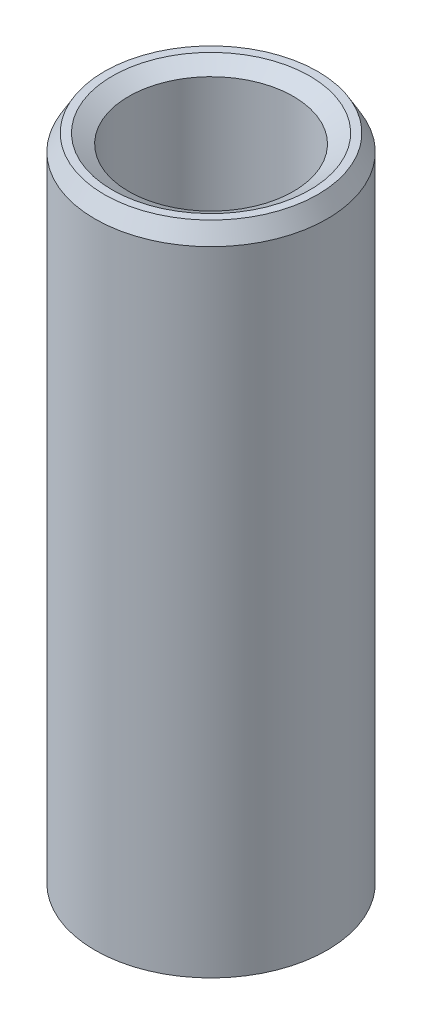
from build123d import *
from OCP.BRepFilletAPI import BRepFilletAPI_MakeChamfer

# Parameters (mm, degrees)
SKETCH1_R           = 15
BOSS_EXTRUDE1_DEPTH = 85.132446652
SKETCH2_R           = 10.638001271
CUT_EXTRUDE1_DEPTH  = 88.735588406
CHAMFER1_SIZE       = 2.114480144
CHAMFER1_SIZE2      = 1.22079568


with BuildPart() as part:
    # Sketch1 → Boss-Extrude1 (new body)
    with BuildSketch(Plane(origin=(0, 0, 0), x_dir=(1, 0, 0), z_dir=(0, 1, 0))):
        Circle(SKETCH1_R)
    extrude(amount=BOSS_EXTRUDE1_DEPTH)

    # Sketch2 → Cut-Extrude1 (cut, through all)
    with BuildSketch(Plane(origin=(0, 0, 0), x_dir=(1, 0, 0), z_dir=(0, 1, 0))):
        Circle(SKETCH2_R)
    extrude(amount=CUT_EXTRUDE1_DEPTH, mode=Mode.SUBTRACT)

    # Chamfer1: one chamfer whose edges measure the first distance from different faces: ONE call of the kernel's chamfer builder (chamfer() names one face for all edges)
    chamfer1_edges_1 = [part.edges().sort_by_distance(p)[0] for p in [
        (-10.638001271, 85.132446652, 0),
    ]]
    chamfer1_side_1 = [part.faces().sort_by_distance(p)[0] for p in [
        (-14.575735931, 85.132446652, 0),
    ]]
    chamfer1_edges_2 = [part.edges().sort_by_distance(p)[0] for p in [
        (-10.638001271, 0, 0),
    ]]
    chamfer1_side_2 = [part.faces().sort_by_distance(p)[0] for p in [
        (-10.638001271, 42.566223326, 0),
    ]]
    chamfer1_edges_3 = [part.edges().sort_by_distance(p)[0] for p in [
        (-15, 0, 0),
    ]]
    chamfer1_side_3 = [part.faces().sort_by_distance(p)[0] for p in [
        (-14.575735931, 0, 0),
    ]]
    chamfer1_edges_4 = [part.edges().sort_by_distance(p)[0] for p in [
        (-15, 85.132446652, 0),
    ]]
    chamfer1_side_4 = [part.faces().sort_by_distance(p)[0] for p in [
        (-15, 42.566223326, 0),
    ]]
    chamfer1 = BRepFilletAPI_MakeChamfer(part.part.solid().wrapped)
    for e in chamfer1_edges_1:
        chamfer1.Add(CHAMFER1_SIZE, CHAMFER1_SIZE2, e.wrapped, chamfer1_side_1[0].wrapped)  # the first distance lies on this face
    for e in chamfer1_edges_2:
        chamfer1.Add(CHAMFER1_SIZE, CHAMFER1_SIZE2, e.wrapped, chamfer1_side_2[0].wrapped)  # the first distance lies on this face
    for e in chamfer1_edges_3:
        chamfer1.Add(CHAMFER1_SIZE, CHAMFER1_SIZE2, e.wrapped, chamfer1_side_3[0].wrapped)  # the first distance lies on this face
    for e in chamfer1_edges_4:
        chamfer1.Add(CHAMFER1_SIZE, CHAMFER1_SIZE2, e.wrapped, chamfer1_side_4[0].wrapped)  # the first distance lies on this face
    add(Compound.cast(chamfer1.Shape()), mode=Mode.REPLACE)


solid = part.part
